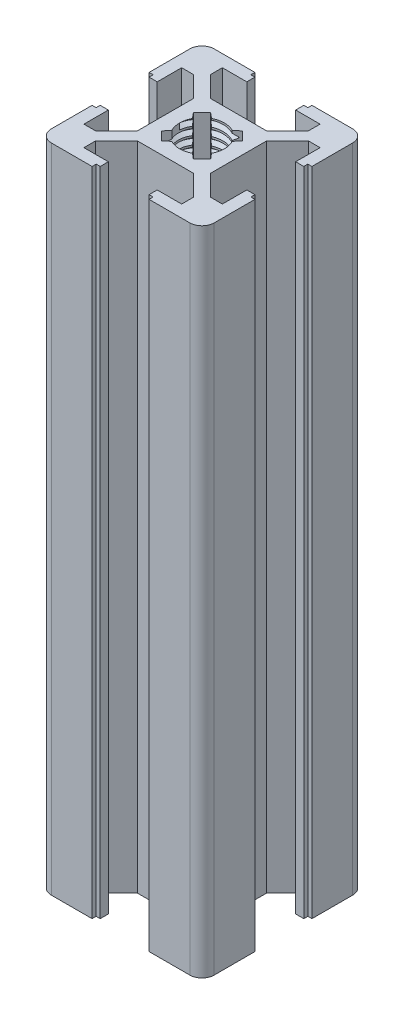
from build123d import *

# Parameters (mm, degrees)
DODANIE_WYCI_GNI_CIE1_DEPTH = 80
THREAD1_PITCH               = 1
THREAD2_PITCH               = 1


with BuildPart() as part:
    # Szkic1 → Dodanie-wyciągnięcie1 (new body)
    # profile 1 of 5: a face of its own
    with BuildSketch(Plane(origin=(0, 0, 0), x_dir=(1, 0, 0), z_dir=(0, 1, 0))):
        with BuildLine():
            Line((-7.06, 6), (-4.5, 3.440546933))
            Line((-4.5, 3.440546933), (-4.5, 4.5))
            Line((-4.5, 4.5), (-3.440546933, 4.5))
            Line((-3.440546933, 4.5), (-6, 7.06))
            Line((-6, 7.06), (-6, 8.5))
            Line((-6, 8.5), (-3, 8.5))
            Line((-3, 8.5), (-3, 9.5))
            Line((-3, 9.5), (-3.5, 9.5))
            Line((-3.5, 9.5), (-3.5, 10))
            Line((-3.5, 10), (-8.5, 10))
            ThreePointArc((-8.5, 10), (-9.560660172, 9.560660172), (-10, 8.5))
            Line((-10, 8.5), (-10, 3.5))
            Line((-10, 3.5), (-9.5, 3.5))
            Line((-9.5, 3.5), (-9.5, 3))
            Line((-9.5, 3), (-8.5, 3))
            Line((-8.5, 3), (-8.5, 6))
            Line((-8.5, 6), (-7.06, 6))
        make_face()
    # profile 2 of 5: a face of its own
    with BuildSketch(Plane(origin=(0, 0, 0), x_dir=(1, 0, 0), z_dir=(0, 1, 0))):
        with BuildLine():
            Line((4.5, 4.5), (4.5, 3.440546933))
            Line((4.5, 3.440546933), (7.06, 6))
            Line((7.06, 6), (8.5, 6))
            Line((8.5, 6), (8.5, 3))
            Line((8.5, 3), (9.5, 3))
            Line((9.5, 3), (9.5, 3.5))
            Line((9.5, 3.5), (10, 3.5))
            Line((10, 3.5), (10, 8.5))
            ThreePointArc((10, 8.5), (9.560660172, 9.560660172), (8.5, 10))
            Line((8.5, 10), (3.5, 10))
            Line((3.5, 10), (3.5, 9.5))
            Line((3.5, 9.5), (3, 9.5))
            Line((3, 9.5), (3, 8.5))
            Line((3, 8.5), (6, 8.5))
            Line((6, 8.5), (6, 7.06))
            Line((6, 7.06), (3.440546933, 4.5))
            Line((3.440546933, 4.5), (4.5, 4.5))
        make_face()
    # profile 3 of 5: a face of its own
    with BuildSketch(Plane(origin=(0, 0, 0), x_dir=(1, 0, 0), z_dir=(0, 1, 0))):
        Polygon((3.440546933, -4.5), (4.5, -4.5), (4.5, -3.440546933), (4.5, 3.440546933), (4.5, 4.5), (3.440546933, 4.5), (-3.440546933, 4.5), (-4.5, 4.5), (-4.5, 3.440546933), (-4.5, -3.440546933), (-4.5, -4.5), (-3.440546933, -4.5), align=None)
        with BuildLine():
            Line((-3.00520382, 1.944543648), (-1.944543648, 3.00520382))
            Line((-1.944543648, 3.00520382), (-1.271309214, 2.438498079))
            ThreePointArc((-1.271309214, 2.438498079), (0, 2.75), (1.271309214, 2.438498079))
            Line((1.271309214, 2.438498079), (1.944543648, 3.00520382))
            Line((1.944543648, 3.00520382), (3.00520382, 1.944543648))
            Line((3.00520382, 1.944543648), (2.438498079, 1.271309214))
            ThreePointArc((2.438498079, 1.271309214), (2.670989491, 0.654457899), (2.75, 0))
            ThreePointArc((2.75, 0), (2.670989491, -0.654457899), (2.438498079, -1.271309214))
            Line((2.438498079, -1.271309214), (3.00520382, -1.944543648))
            Line((3.00520382, -1.944543648), (1.944543648, -3.00520382))
            Line((1.944543648, -3.00520382), (1.271309214, -2.438498079))
            ThreePointArc((1.271309214, -2.438498079), (0, -2.75), (-1.271309214, -2.438498079))
            Line((-1.271309214, -2.438498079), (-1.944543648, -3.00520382))
            Line((-1.944543648, -3.00520382), (-3.00520382, -1.944543648))
            Line((-3.00520382, -1.944543648), (-2.438498079, -1.271309214))
            ThreePointArc((-2.438498079, -1.271309214), (-2.75, 0), (-2.438498079, 1.271309214))
            Line((-2.438498079, 1.271309214), (-3.00520382, 1.944543648))
        make_face(mode=Mode.SUBTRACT)
    # profile 4 of 5: a face of its own
    with BuildSketch(Plane(origin=(0, 0, 0), x_dir=(1, 0, 0), z_dir=(0, 1, 0))):
        with BuildLine():
            Line((-6, -7.06), (-3.440546933, -4.5))
            Line((-3.440546933, -4.5), (-4.5, -4.5))
            Line((-4.5, -4.5), (-4.5, -3.440546933))
            Line((-4.5, -3.440546933), (-7.06, -6))
            Line((-7.06, -6), (-8.5, -6))
            Line((-8.5, -6), (-8.5, -3))
            Line((-8.5, -3), (-9.5, -3))
            Line((-9.5, -3), (-9.5, -3.5))
            Line((-9.5, -3.5), (-10, -3.5))
            Line((-10, -3.5), (-10, -8.5))
            ThreePointArc((-10, -8.5), (-9.560660172, -9.560660172), (-8.5, -10))
            Line((-8.5, -10), (-3.5, -10))
            Line((-3.5, -10), (-3.5, -9.5))
            Line((-3.5, -9.5), (-3, -9.5))
            Line((-3, -9.5), (-3, -8.5))
            Line((-3, -8.5), (-6, -8.5))
            Line((-6, -8.5), (-6, -7.06))
        make_face()
    # profile 5 of 5: a face of its own
    with BuildSketch(Plane(origin=(0, 0, 0), x_dir=(1, 0, 0), z_dir=(0, 1, 0))):
        with BuildLine():
            Line((4.5, -3.440546933), (4.5, -4.5))
            Line((4.5, -4.5), (3.440546933, -4.5))
            Line((3.440546933, -4.5), (6, -7.06))
            Line((6, -7.06), (6, -8.5))
            Line((6, -8.5), (3, -8.5))
            Line((3, -8.5), (3, -9.5))
            Line((3, -9.5), (3.5, -9.5))
            Line((3.5, -9.5), (3.5, -10))
            Line((3.5, -10), (8.5, -10))
            ThreePointArc((8.5, -10), (9.560660172, -9.560660172), (10, -8.5))
            Line((10, -8.5), (10, -3.5))
            Line((10, -3.5), (9.5, -3.5))
            Line((9.5, -3.5), (9.5, -3))
            Line((9.5, -3), (8.5, -3))
            Line((8.5, -3), (8.5, -6))
            Line((8.5, -6), (7.06, -6))
            Line((7.06, -6), (4.5, -3.440546933))
        make_face()
    extrude(amount=DODANIE_WYCI_GNI_CIE1_DEPTH)

    # Thread1: the profile of Thread Profile1 profile screwed along a right-hand helix of 20 turns, 8 arcs to a turn; built about Z, then put on its axis
    thread1_z = Axis((0, 0, 0), (0, 0, 1))
    thread1_corners = [(2.7497, 0, -0.000173205), (3.291265875, 0, 0.312499999), (3.291265875, 0, 0.437499999), (2.7497, 0, 0.750173202)]
    with BuildLine(mode=Mode.PRIVATE) as thread1_profile:
        Line(thread1_corners[0], thread1_corners[1])
        Line(thread1_corners[1], thread1_corners[2])
        Line(thread1_corners[2], thread1_corners[3])
        Line(thread1_corners[3], thread1_corners[0])
    thread1_cap = Face(thread1_profile.wire())
    thread1_turn_angles = [0, 22.5, 45, 67.5, 90, 112.5, 135, 157.5, 180, 202.5, 225, 247.5, 270, 292.5, 315, 337.5, 360]
    thread1_turn_weights = [1, 0.9238795325112867, 1, 0.9238795325112867, 1, 0.9238795325112867, 1, 0.9238795325112867, 1, 0.9238795325112867, 1, 0.9238795325112867, 1, 0.9238795325112867, 1, 0.9238795325112867, 1]
    thread1_turn_rails = [Edge.make_bspline([Vector(p[0], p[1], 0).rotate(thread1_z, thread1_turn_angles[k]) / thread1_turn_weights[k] + Vector(0, 0, p[2] + THREAD1_PITCH * thread1_turn_angles[k] / 360) for k in range(17)], [0, 0, 0, 1, 1, 2, 2, 3, 3, 4, 4, 5, 5, 6, 6, 7, 7, 8, 8, 8], 2, thread1_turn_weights) for p in thread1_corners]
    thread1_turn_sides = [Face.make_surface_from_curves(thread1_turn_rails[p[0]], thread1_turn_rails[p[1]]) for p in [(0, 1), (1, 2), (2, 3), (3, 0)]]
    thread1 = Plane(origin=(0, 80, 0), x_dir=(-1, 0, 0), z_dir=(0, -1, 0)) * Solid(Shell([*[p.moved(Location((0, 0, THREAD1_PITCH * i))) for i in range(20) for p in thread1_turn_sides], thread1_cap, thread1_cap.rotate(thread1_z, 7200).moved(Location((0, 0, THREAD1_PITCH * 7200 / 360)))]))
    add(thread1, mode=Mode.SUBTRACT)

    # Thread2: the profile of Thread Profile2 profile screwed along a right-hand helix of 20 turns, 8 arcs to a turn; built about Z, then put on its axis
    thread2_z = Axis((0, 0, 0), (0, 0, 1))
    thread2_corners = [(2.7497, 0, -0.000173205), (3.291265875, 0, 0.312499999), (3.291265875, 0, 0.437499999), (2.7497, 0, 0.750173202)]
    with BuildLine(mode=Mode.PRIVATE) as thread2_profile:
        Line(thread2_corners[0], thread2_corners[1])
        Line(thread2_corners[1], thread2_corners[2])
        Line(thread2_corners[2], thread2_corners[3])
        Line(thread2_corners[3], thread2_corners[0])
    thread2_cap = Face(thread2_profile.wire())
    thread2_turn_angles = [0, 22.5, 45, 67.5, 90, 112.5, 135, 157.5, 180, 202.5, 225, 247.5, 270, 292.5, 315, 337.5, 360]
    thread2_turn_weights = [1, 0.9238795325112867, 1, 0.9238795325112867, 1, 0.9238795325112867, 1, 0.9238795325112867, 1, 0.9238795325112867, 1, 0.9238795325112867, 1, 0.9238795325112867, 1, 0.9238795325112867, 1]
    thread2_turn_rails = [Edge.make_bspline([Vector(p[0], p[1], 0).rotate(thread2_z, thread2_turn_angles[k]) / thread2_turn_weights[k] + Vector(0, 0, p[2] + THREAD2_PITCH * thread2_turn_angles[k] / 360) for k in range(17)], [0, 0, 0, 1, 1, 2, 2, 3, 3, 4, 4, 5, 5, 6, 6, 7, 7, 8, 8, 8], 2, thread2_turn_weights) for p in thread2_corners]
    thread2_turn_sides = [Face.make_surface_from_curves(thread2_turn_rails[p[0]], thread2_turn_rails[p[1]]) for p in [(0, 1), (1, 2), (2, 3), (3, 0)]]
    thread2 = Plane(origin=(0, 0, 0), x_dir=(1, 0, 0), z_dir=(0, 1, 0)) * Solid(Shell([*[p.moved(Location((0, 0, THREAD2_PITCH * i))) for i in range(20) for p in thread2_turn_sides], thread2_cap, thread2_cap.rotate(thread2_z, 7200).moved(Location((0, 0, THREAD2_PITCH * 7200 / 360)))]))
    add(thread2, mode=Mode.SUBTRACT)


solid = part.part
